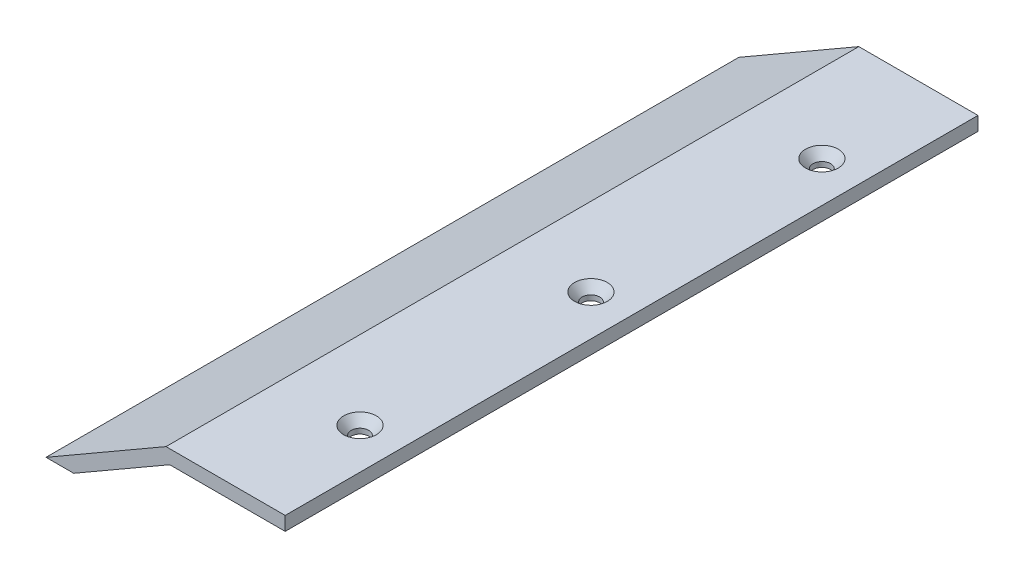
from build123d import *

# Parameters (mm, degrees)
SALIENTE_EXTRUIR1_DEPTH                              = 75
AVELLANADO_PARA_TORNILLO_CON_CABEZA_OVAL_D           = 3.7973
AVELLANADO_PARA_TORNILLO_CON_CABEZA_OVAL_DEPTH       = 20
AVELLANADO_PARA_TORNILLO_CON_CABEZA_OVAL_CSINK_D     = 7.0866
AVELLANADO_PARA_TORNILLO_CON_CABEZA_OVAL_CSINK_ANGLE = 82
AVELLANADO_PARA_TORNILLO_CON_CABEZA_OVAL_TIP         = 1.140824014


with BuildPart() as part:
    # Croquis1 → Saliente-Extruir1 (new, symmetric)
    with BuildSketch(Plane.XY):
        Polygon((25, 0), (25, 3), (-0.803847577, 3), (-26.784609691, -12), (-20.784609691, -12), (0, 0), align=None)
    extrude(amount=SALIENTE_EXTRUIR1_DEPTH, both=True)

    # Avellanado para tornillo con cabeza ovalada de #61
    with Locations(Plane(origin=(16.2, 3, -50), x_dir=(1, 0, 0), z_dir=(0, 1, 0))):
        with Locations((0, 0), (0, -50), (0, -100)):
            CounterSinkHole(AVELLANADO_PARA_TORNILLO_CON_CABEZA_OVAL_D / 2, AVELLANADO_PARA_TORNILLO_CON_CABEZA_OVAL_CSINK_D / 2, depth=AVELLANADO_PARA_TORNILLO_CON_CABEZA_OVAL_DEPTH, counter_sink_angle=AVELLANADO_PARA_TORNILLO_CON_CABEZA_OVAL_CSINK_ANGLE)
            with Locations((0, 0, -(AVELLANADO_PARA_TORNILLO_CON_CABEZA_OVAL_DEPTH + AVELLANADO_PARA_TORNILLO_CON_CABEZA_OVAL_TIP / 2))):  # 118° drill point
                Cone(0, AVELLANADO_PARA_TORNILLO_CON_CABEZA_OVAL_D / 2, AVELLANADO_PARA_TORNILLO_CON_CABEZA_OVAL_TIP, mode=Mode.SUBTRACT)


solid = part.part
